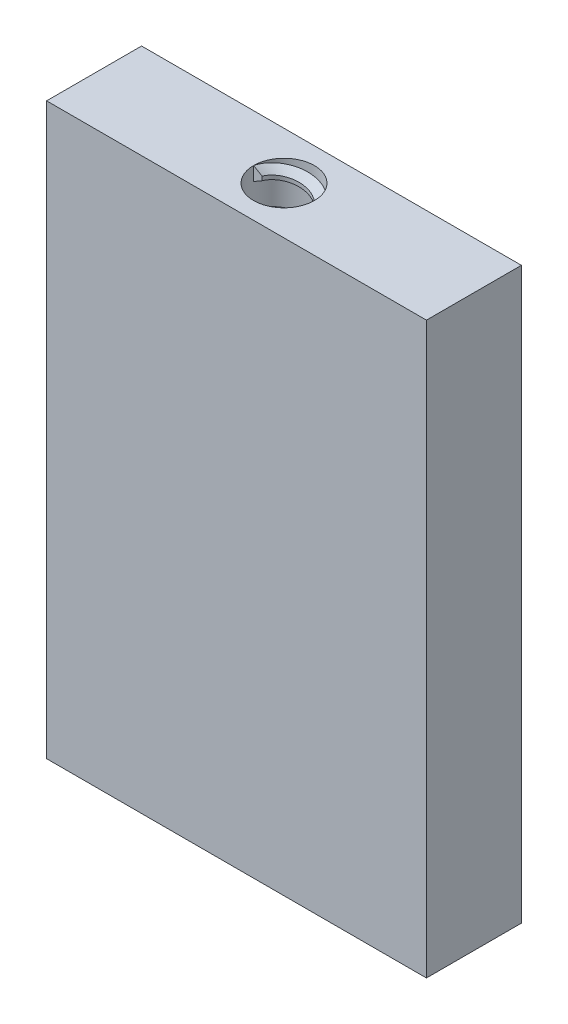
from build123d import *

# Parameters (mm, degrees)
FLIP_SIGN_DEPTH                = 6.35
FLIP_SIGN_DEPTH_BACK           = 6.35
SKETCH2_W                      = 50.8
SKETCH2_H                      = 76.2
F_95_0_32_DIAMETER_HOLE1_D     = 8.128
F_95_0_32_DIAMETER_HOLE1_DEPTH = 76.2
F_95_0_32_DIAMETER_HOLE1_TIP   = 2.441897556
THREAD2_PITCH                  = 5.08
SKETCH22_W                     = 50.8
SKETCH22_H                     = 12.7
CUT_EXTRUDE1_DEPTH             = 12.7


with BuildPart() as part:
    # Sketch2 → Flip Sign (new, two sides: drawn at the far end of the back side and taken through both)
    with BuildSketch(Plane.XY.offset(-FLIP_SIGN_DEPTH_BACK)):
        Rectangle(SKETCH2_W, SKETCH2_H)
    extrude(amount=FLIP_SIGN_DEPTH + FLIP_SIGN_DEPTH_BACK)

    # #95 (0.32) Diameter Hole1
    with Locations(Plane(origin=(0, 38.1, 0), x_dir=(1, 0, 0), z_dir=(0, 1, 0))):
        with Locations((0, 0)):
            Hole(F_95_0_32_DIAMETER_HOLE1_D / 2, depth=F_95_0_32_DIAMETER_HOLE1_DEPTH)
            with Locations((0, 0, -(F_95_0_32_DIAMETER_HOLE1_DEPTH + F_95_0_32_DIAMETER_HOLE1_TIP / 2))):  # 118° drill point
                Cone(0, F_95_0_32_DIAMETER_HOLE1_D / 2, F_95_0_32_DIAMETER_HOLE1_TIP, mode=Mode.SUBTRACT)

    # Thread2: the profile of Thread Profile6 profile screwed along a right-hand helix of 15 turns, 12 arcs to a turn; built about Z, then put on its axis
    thread2_z = Axis((0, 0, 0), (0, 0, 1))
    thread2_corners = [(4.0643, 0, -0.000173205), (4.0643, 0, 1.852256533), (2.918320565, 0, 1.190624997), (2.918320565, 0, 0.66145833)]
    with BuildLine(mode=Mode.PRIVATE) as thread2_profile:
        Line(thread2_corners[0], thread2_corners[1])
        Line(thread2_corners[1], thread2_corners[2])
        Line(thread2_corners[2], thread2_corners[3])
        Line(thread2_corners[3], thread2_corners[0])
    thread2_cap = Face(thread2_profile.wire())
    thread2_turn_angles = [0, 15, 30, 45, 60, 75, 90, 105, 120, 135, 150, 165, 180, 195, 210, 225, 240, 255, 270, 285, 300, 315, 330, 345, 360]
    thread2_turn_weights = [1, 0.9659258262890683, 1, 0.9659258262890683, 1, 0.9659258262890683, 1, 0.9659258262890683, 1, 0.9659258262890683, 1, 0.9659258262890683, 1, 0.9659258262890683, 1, 0.9659258262890683, 1, 0.9659258262890683, 1, 0.9659258262890683, 1, 0.9659258262890683, 1, 0.9659258262890683, 1]
    thread2_turn_rails = [Edge.make_bspline([Vector(p[0], p[1], 0).rotate(thread2_z, thread2_turn_angles[k]) / thread2_turn_weights[k] + Vector(0, 0, p[2] + THREAD2_PITCH * thread2_turn_angles[k] / 360) for k in range(25)], [0, 0, 0, 1, 1, 2, 2, 3, 3, 4, 4, 5, 5, 6, 6, 7, 7, 8, 8, 9, 9, 10, 10, 11, 11, 12, 12, 12], 2, thread2_turn_weights) for p in thread2_corners]
    thread2_turn_sides = [Face.make_surface_from_curves(thread2_turn_rails[p[0]], thread2_turn_rails[p[1]]) for p in [(0, 1), (1, 2), (2, 3), (3, 0)]]
    thread2 = Plane(origin=(0, 38.1, 0), x_dir=(-1, 0, 0), z_dir=(0, -1, 0)) * Solid(Shell([*[p.moved(Location((0, 0, THREAD2_PITCH * i))) for i in range(15) for p in thread2_turn_sides], thread2_cap, thread2_cap.rotate(thread2_z, 5400).moved(Location((0, 0, THREAD2_PITCH * 5400 / 360)))]))
    add(thread2)

    # Sketch22 → Cut-Extrude1 (cut)
    with BuildSketch(Plane.XZ.offset(38.1)):
        Rectangle(SKETCH22_W, SKETCH22_H)
    extrude(amount=CUT_EXTRUDE1_DEPTH, mode=Mode.SUBTRACT)


solid = part.part
